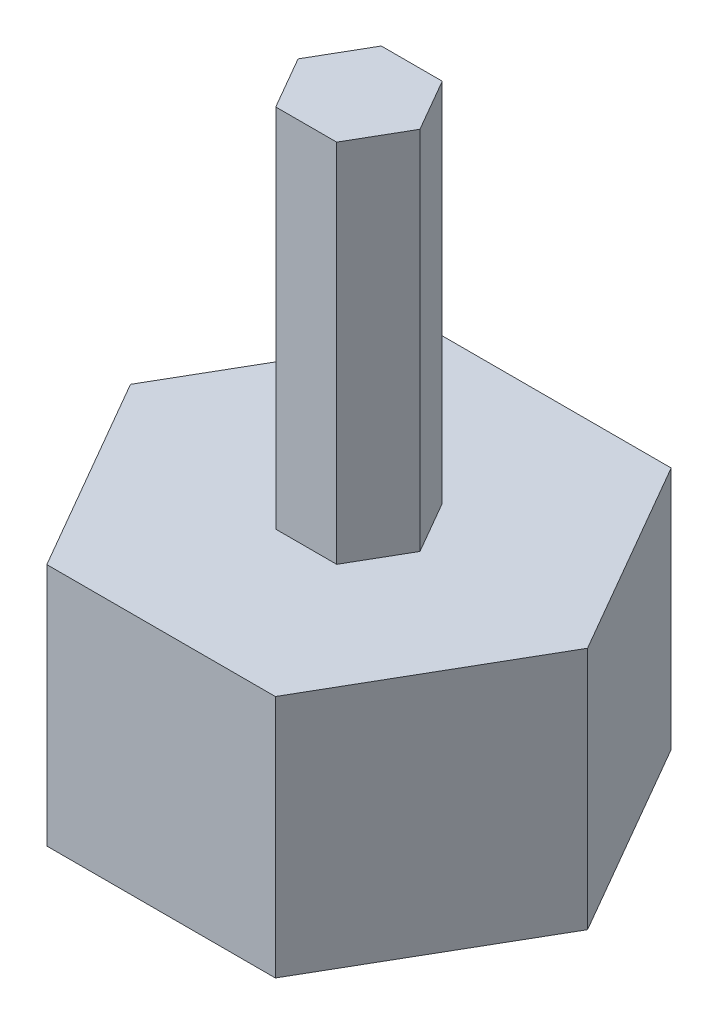
from build123d import *

# Parameters (mm, degrees)
BOSS_EXTRUDE1_DEPTH = 6
BOSS_EXTRUDE2_DEPTH = 4


with BuildPart() as part:
    # Sketch1 → Boss-Extrude1 (new body)
    with BuildSketch(Plane(origin=(0, 0, 0), x_dir=(1, 0, 0), z_dir=(0, 1, 0))):
        Polygon((1, 0), (0.5, 0.866025404), (-0.5, 0.866025404), (-1, 0), (-0.5, -0.866025404), (0.5, -0.866025404), align=None)
    extrude(amount=BOSS_EXTRUDE1_DEPTH)

    # Sketch2 → Boss-Extrude2 (add)
    with BuildSketch(Plane.XZ):
        Polygon((3.75, 0), (1.875, 3.247595264), (-1.875, 3.247595264), (-3.75, 0), (-1.875, -3.247595264), (1.875, -3.247595264), align=None)
    extrude(amount=BOSS_EXTRUDE2_DEPTH)


solid = part.part
